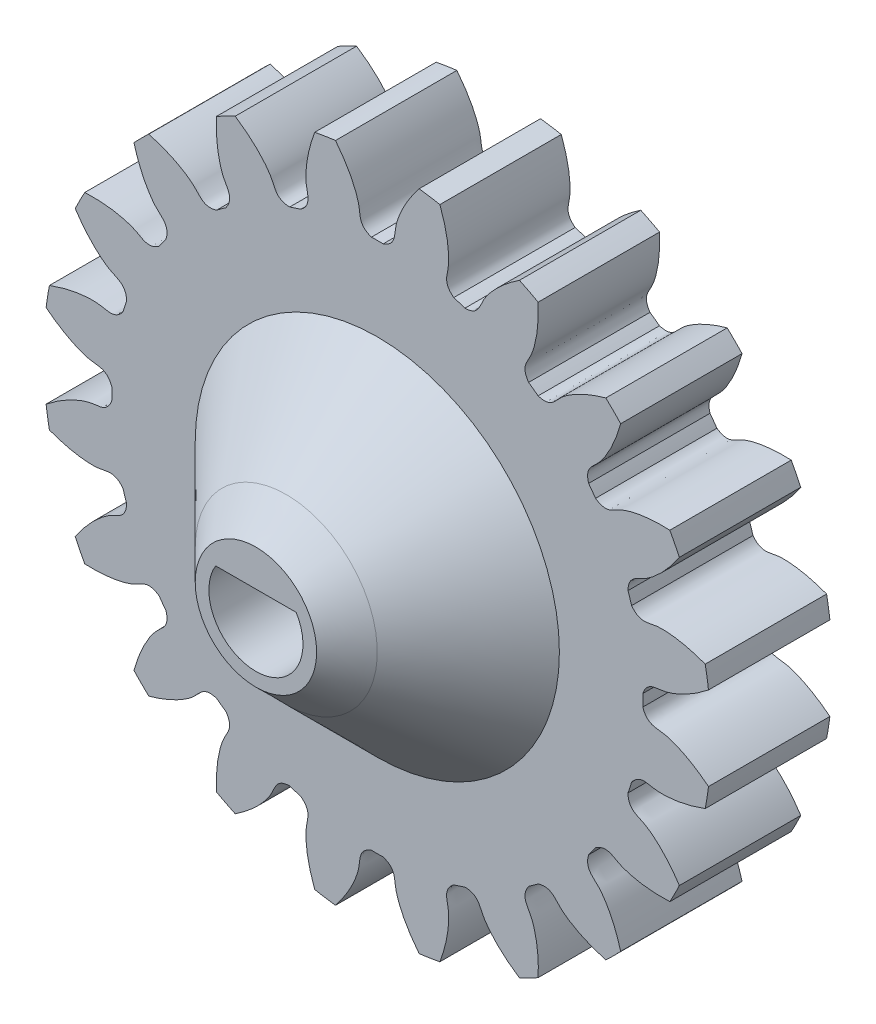
from build123d import *

# Parameters (mm, degrees)
SKETCH_1_R               = 11
EXTRUDE_1_DEPTH          = 5
CUT_EXTRUDE_1_DEPTH      = 17.340134638
PATTERN_CIRCULAR_1_COUNT = 20
CUT_EXTRUDE_2_DEPTH      = 10
SKETCH_5_W               = 49.010891267
SKETCH_5_H               = 34.890106267
CUT_EXTRUDE_3_DEPTH      = 1
SKETCH_6_R               = 7.5
SKETCH_6_R_2             = 3
CUT_EXTRUDE_4_DEPTH      = 1
CHAMFER_2_SIZE           = 1
SKETCH_7_R               = 3
EXTRUDE_2_DEPTH          = 4
CHAMFER_3_SIZE           = 3
CUT_EXTRUDE_START        = -8
CUT_EXTRUDE_5_DEPTH      = 8
CHAMFER_4_SIZE           = 1


with BuildPart() as part:
    # 草图1 → 凸台-拉伸1 (new body)
    with BuildSketch(Plane.XY):
        Circle(SKETCH_1_R)
    extrude(amount=EXTRUDE_1_DEPTH)

    # 草图2 → 切除-拉伸1 (cut, through all)
    with BuildSketch(Plane.XY):
        with BuildLine():
            ThreePointArc((0.1933166, 8.747864236), (0, 8.75), (-0.1933166, 8.747864236))
            add(Edge.make_bspline(
                [(-0.1933166, 8.747864236), (-0.611189405, 8.893475512), (-0.557084099, 9.187113699), (-0.612897056, 9.470009403), (-0.618892186, 9.497556614), (-0.62631089, 9.528634615), (-0.635292097, 9.563196836), (-0.64597914, 9.601191497), (-0.658512055, 9.642562828), (-0.673029871, 9.687250733), (-0.68966975, 9.735190947), (-0.7085671, 9.786315045), (-0.729855399, 9.840550501), (-0.753666102, 9.897820731), (-0.780128531, 9.958045151), (-0.809369765, 10.021139231), (-0.841514533, 10.087014551), (-0.876685117, 10.155578861), (-0.915001238, 10.22673615), (-0.956579966, 10.300386704), (-1.001535609, 10.376427181), (-1.049979626, 10.454750678), (-1.102020521, 10.535246805), (-1.157763756, 10.617801764), (-1.217311651, 10.70229842), (-1.280763301, 10.78861639), (-1.34821448, 10.876632121), (-1.419757562, 10.966218973), (-1.495481426, 11.057247311), (-1.575471385, 11.149584594), (-1.659809097, 11.243095463), (-1.748572489, 11.337641835), (-1.841835684, 11.433083002), (-1.939668926, 11.529275727), (-2.042138506, 11.626074339), (-2.149306698, 11.723330842), (-2.261231689, 11.820895011), (-2.377967518, 11.918614499), (-2.499564012, 12.016334946), (-2.626066734, 12.113900082), (-2.757516899, 12.21115184), (-2.941473591, 12.341639868), (-3.083932413, 12.436332601), (-3.181157982, 12.49825186)],
                knots=[0, 0, 0, 0, 0.165916003, 0.170905922, 0.176663519, 0.183188797, 0.190481754, 0.198542391, 0.207370708, 0.216966704, 0.22733038, 0.238461736, 0.250360771, 0.263027487, 0.276461881, 0.290663956, 0.30563371, 0.321371144, 0.337876258, 0.355149051, 0.373189524, 0.391997677, 0.411573509, 0.431917021, 0.453028213, 0.474907084, 0.497553636, 0.520967867, 0.545149777, 0.570099367, 0.595816637, 0.622301587, 0.649554216, 0.677574526, 0.706362514, 0.735918183, 0.766241531, 0.797332559, 0.829191267, 0.861817654, 0.895211721, 0.929373468, 1, 1, 1, 1], degree=3))
            ThreePointArc((-3.181157982, 12.49825186), (0, 12.89674632), (3.181157982, 12.49825186))
            add(Edge.make_bspline(
                [(0.1933166, 8.747864236), (0.611189405, 8.893475512), (0.557084099, 9.187113699), (0.612897056, 9.470009403), (0.618892186, 9.497556614), (0.62631089, 9.528634615), (0.635292097, 9.563196836), (0.64597914, 9.601191497), (0.658512055, 9.642562828), (0.673029871, 9.687250733), (0.68966975, 9.735190947), (0.7085671, 9.786315045), (0.729855399, 9.840550501), (0.753666102, 9.897820731), (0.780128531, 9.958045151), (0.809369765, 10.021139231), (0.841514533, 10.087014551), (0.876685117, 10.155578861), (0.915001238, 10.22673615), (0.956579966, 10.300386704), (1.001535609, 10.376427181), (1.049979626, 10.454750678), (1.102020521, 10.535246805), (1.157763756, 10.617801764), (1.217311651, 10.70229842), (1.280763301, 10.78861639), (1.34821448, 10.876632121), (1.419757562, 10.966218973), (1.495481426, 11.057247311), (1.575471385, 11.149584594), (1.659809097, 11.243095463), (1.748572489, 11.337641835), (1.841835684, 11.433083002), (1.939668926, 11.529275727), (2.042138506, 11.626074339), (2.149306698, 11.723330842), (2.261231689, 11.820895011), (2.377967518, 11.918614499), (2.499564012, 12.016334946), (2.626066734, 12.113900082), (2.757516899, 12.21115184), (2.941473591, 12.341639868), (3.083932413, 12.436332601), (3.181157982, 12.49825186)],
                knots=[0, 0, 0, 0, 0.165916003, 0.170905922, 0.176663519, 0.183188797, 0.190481754, 0.198542391, 0.207370708, 0.216966704, 0.22733038, 0.238461736, 0.250360771, 0.263027487, 0.276461881, 0.290663956, 0.30563371, 0.321371144, 0.337876258, 0.355149051, 0.373189524, 0.391997677, 0.411573509, 0.431917021, 0.453028213, 0.474907084, 0.497553636, 0.520967867, 0.545149777, 0.570099367, 0.595816637, 0.622301587, 0.649554216, 0.677574526, 0.706362514, 0.735918183, 0.766241531, 0.797332559, 0.829191267, 0.861817654, 0.895211721, 0.929373468, 1, 1, 1, 1], degree=3))
        make_face()
    cut_extrude_1 = extrude(amount=CUT_EXTRUDE_1_DEPTH, mode=Mode.SUBTRACT)

    # 阵列(圆周)1: 切除-拉伸1 ×20 about axis
    pattern_circular_1_axis = Axis((0, 0, -0.25), (0, 0, 1))
    for i in range(1, PATTERN_CIRCULAR_1_COUNT):
        add(cut_extrude_1.rotate(pattern_circular_1_axis, i * 360 / PATTERN_CIRCULAR_1_COUNT), mode=Mode.SUBTRACT)

    # 草图4 → 切除-拉伸2 (cut)
    with BuildSketch(Plane.XY.offset(5)):
        with BuildLine():
            Line((-1.327591805, 0.8), (1.327591805, 0.8))
            ThreePointArc((1.327591805, 0.8), (0, -1.55), (-1.327591805, 0.8))
        make_face()
    extrude(amount=-CUT_EXTRUDE_2_DEPTH, mode=Mode.SUBTRACT)

    # 草图5 → 切除-拉伸3 (cut)
    with BuildSketch(Plane.XY.offset(5)):
        with Locations((2.535932779, -0.947496561)):
            Rectangle(SKETCH_5_W, SKETCH_5_H)
    extrude(amount=-CUT_EXTRUDE_3_DEPTH, mode=Mode.SUBTRACT)

    # 草图6 → 切除-拉伸4 (cut)
    with BuildSketch(Plane(origin=(0, 0, 0), x_dir=(-1, 0, 0), z_dir=(0, 0, -1))):
        Circle(SKETCH_6_R)
        Circle(SKETCH_6_R_2, mode=Mode.SUBTRACT)
    extrude(amount=-CUT_EXTRUDE_4_DEPTH, mode=Mode.SUBTRACT)

    # 倒角2
    chamfer_2_edges = [part.edges().sort_by_distance(p)[0] for p in [
        (3, 0, 1),
    ]]
    chamfer(chamfer_2_edges, length=CHAMFER_2_SIZE - 0.0001)  # a hair under: the kernel refuses the full size

    # 草图7 → 凸台-拉伸2 (add)
    with BuildSketch(Plane.XY.offset(4)):
        Circle(SKETCH_7_R)
    extrude(amount=EXTRUDE_2_DEPTH)

    # 倒角3
    chamfer_3_edges = [part.edges().sort_by_distance(p)[0] for p in [
        (-3, 0, 4),
    ]]
    chamfer(chamfer_3_edges, length=CHAMFER_3_SIZE)

    # 草图8 → 切除-拉伸5 (cut)
    with BuildSketch(Plane(origin=(0, 0, 4), x_dir=(-1, 0, 0), z_dir=(0, 0, -1)).offset(CUT_EXTRUDE_START)):
        with BuildLine():
            Line((1.327591805, 0.8), (-1.327591805, 0.8))
            ThreePointArc((-1.327591805, 0.8), (0, -1.55), (1.327591805, 0.8))
        make_face()
    extrude(amount=CUT_EXTRUDE_5_DEPTH, mode=Mode.SUBTRACT)

    # 倒角4
    chamfer_4_edges = [part.edges().sort_by_distance(p)[0] for p in [
        (-3, 0, 8),
    ]]
    chamfer(chamfer_4_edges, length=CHAMFER_4_SIZE - 0.0001)  # a hair under: the kernel refuses the full size


solid = part.part
